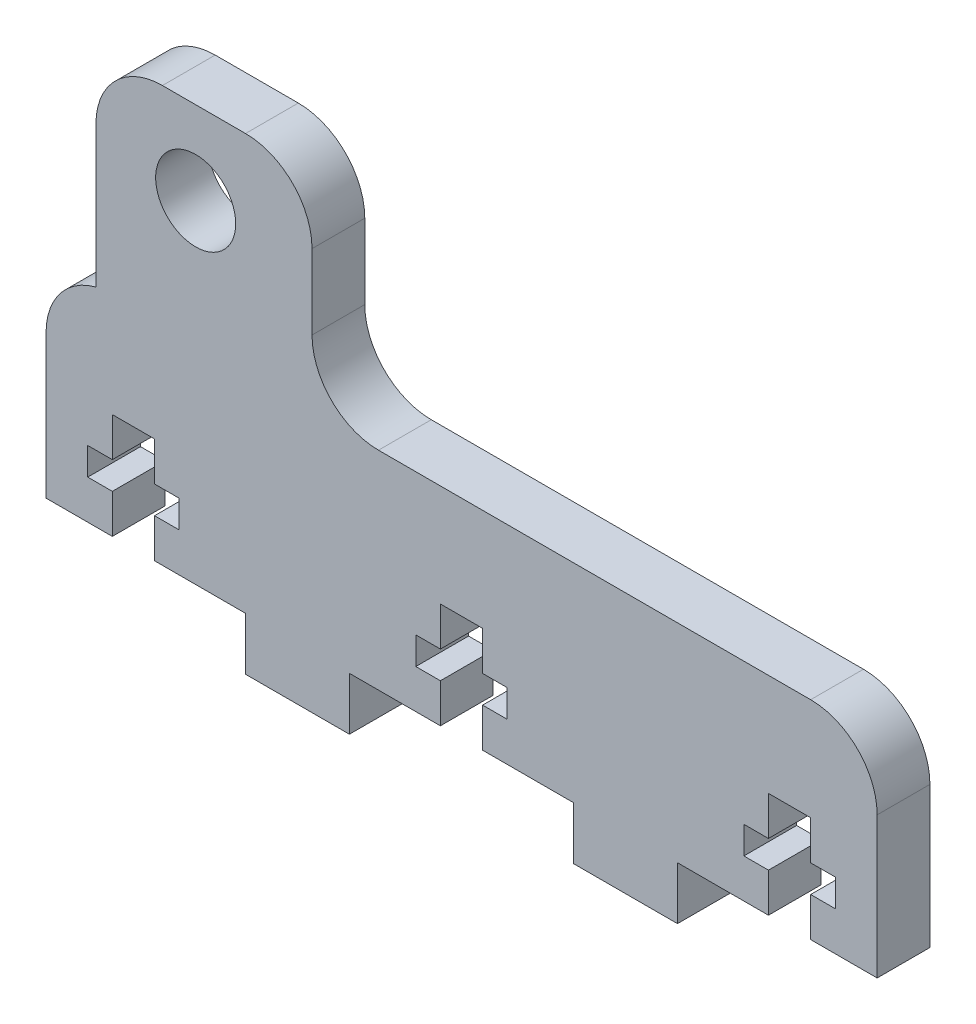
from build123d import *

# Parameters (mm, degrees)
BOSS_EXTRUDE1_DEPTH = 6.35
SKETCH2_R           = 4.815
CUT_EXTRUDE1_DEPTH  = 6.35
CUT_EXTRUDE2_DEPTH  = 112.983581386
FILLET1_R           = 8


with BuildPart() as part:
    # Sketch1 → Boss-Extrude1 (new body)
    with BuildSketch(Plane.XY):
        Polygon((36.5, 0), (63.4742, 0), (63.4742, -6.35), (75.9742, -6.35), (75.9742, 0), (100, 0), (100, 25), (32, 25), (32, 50), (6, 50), (6, 25), (0, 25), (0, 0), (24, 0), (24, -6.35), (36.5, -6.35), align=None)
    extrude(amount=BOSS_EXTRUDE1_DEPTH)

    # Sketch2 → Cut-Extrude1 (cut)
    with BuildSketch(Plane.XY.offset(6.35)):
        with Locations((18, 40)):
            Circle(SKETCH2_R)
    extrude(amount=-CUT_EXTRUDE1_DEPTH, mode=Mode.SUBTRACT)

    # Sketch3 → Cut-Extrude2 (cut, through all)
    with BuildSketch(Plane.XY.offset(6.35)):
        Polygon((7.9729, 0), (7.9729, 4.7), (5.0138, 4.7), (5.0138, 8), (7.9729, 8), (7.9729, 12.7), (13.0529, 12.7), (13.0529, 8), (16.012, 8), (16.012, 4.7), (13.0529, 4.7), (13.0529, 0), align=None)
        Polygon((47.4471, 12.7), (52.5271, 12.7), (52.5271, 8), (55.4862, 8), (55.4862, 4.7), (52.5271, 4.7), (52.5271, 0), (47.4471, 0), (47.4471, 4.7), (44.488, 4.7), (44.488, 8), (47.4471, 8), align=None)
        Polygon((86.9213, 12.7), (92.0013, 12.7), (92.0013, 8), (94.9604, 8), (94.9604, 4.7), (92.0013, 4.7), (92.0013, 0), (86.9213, 0), (86.9213, 4.7), (83.9622, 4.7), (83.9622, 8), (86.9213, 8), align=None)
    extrude(amount=-CUT_EXTRUDE2_DEPTH, mode=Mode.SUBTRACT)

    # Fillet1
    # the kernel refuses this fillet: 8 mm, written as the material it adds along each edge
    with BuildSketch(Plane(origin=(32, 25, 0), x_dir=(0, 1, 0), z_dir=(0, 0, 1))) as fillet1_piece_1:
        with BuildLine():
            CenterArc((FILLET1_R, -FILLET1_R), FILLET1_R, 90, 90)
            Line((0, -FILLET1_R), (0, 0))
            Line((0, 0), (FILLET1_R, 0))
        make_face()
    extrude(amount=6.35)
    # the kernel refuses this fillet: 8 mm, written as the material it takes off along each edge
    with BuildSketch(Plane(origin=(0, 25, -19.364916731), x_dir=(0, -1, 0), z_dir=(0, 0, 1))) as fillet1_2_piece_1:
        with BuildLine():
            CenterArc((7.745966692, 8), FILLET1_R, 194.477512186, 75.522487814)
            Line((0, 6), (0, 0))
            Line((0, 0), (7.745966692, 0))
        make_face()
    extrude(amount=45.079833462, mode=Mode.SUBTRACT)
    with BuildSketch(Plane(origin=(6, 50, -20), x_dir=(0, -1, 0), z_dir=(0, 0, 1)), Plane(origin=(32, 50, -20), x_dir=(-1, 0, 0), z_dir=(0, 0, 1)), Plane(origin=(100, 25, -20), x_dir=(-1, 0, 0), z_dir=(0, 0, 1))) as fillet1_2_piece_2:
        with BuildLine():
            CenterArc((FILLET1_R, FILLET1_R), FILLET1_R, 180, 90)
            Line((0, FILLET1_R), (0, 0))
            Line((0, 0), (FILLET1_R, 0))
        make_face()
    extrude(amount=46.35, mode=Mode.SUBTRACT)


solid = part.part
